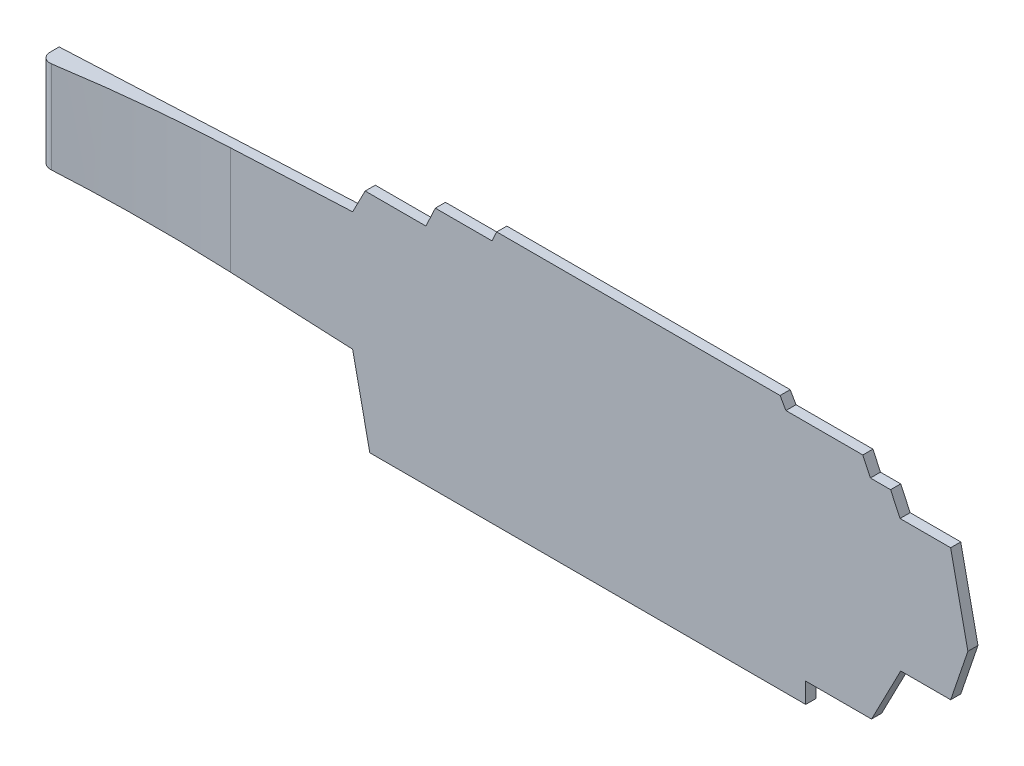
from build123d import *

# Parameters (mm, degrees)
EXTRUDE_1_DEPTH          = 50
EXTRUDE_3_DEPTH          = 50
CUT_EXTRUDE_2_DEPTH      = 4594.874479338
CUT_EXTRUDE_2_DEPTH_BACK = 4594.874479338
FILLET_4_R               = 50


with BuildPart() as part:
    # 草图1 → 凸台-拉伸1 (new body)
    with BuildSketch(Plane.XY):
        Polygon((0, 0), (0, 225), (1500, 294.39), (1562.072973457, 414.39), (1862.072973457, 414.39), (1908.703739273, 514.39), (2188.703739273, 514.39), (2212.019122181, 564.39), (3612.019122181, 564.39), (3640.88663564, 514.39), (4020.88663564, 514.39), (4058.191248292, 434.39), (4158.191248292, 434.39), (4204.822014108, 334.39), (4454.822014108, 334.39), (4539.989566047, -66.291829202), (4454.969566047, -316.291829202), (4208.14, -316.291829202), (4063.94, -594.39), (3738.77, -594.39), (3738.77, -694.39), (1585.02, -694.39), (1500, -293.676807666), (0, -224.286807666), align=None)
    extrude(amount=EXTRUDE_1_DEPTH)

    # 草图2 → 凸台-拉伸3 (add)
    with BuildSketch(Plane.XY.offset(50)):
        Polygon((0, 225), (1500, 294.39), (1500, -293.676807666), (0, -224.286807666), align=None)
    extrude(amount=EXTRUDE_3_DEPTH)

    # 草图8 → 切除-拉伸2 (cut, two sides: drawn at the far end of the back side and taken through both)
    with BuildSketch(Plane(origin=(0, 0, 0), x_dir=(1, 0, 0), z_dir=(0, 1, 0)).offset(-CUT_EXTRUDE_2_DEPTH_BACK)):
        with BuildLine():
            Line((1500, -50), (897.23, -50))
            ThreePointArc((897.23, -50), (447.918951588, -62.509689668), (0, -100))
            Line((0, -100), (1500, -286.15247301))
            Line((1500, -286.15247301), (1500, -50))
        make_face()
    extrude(amount=CUT_EXTRUDE_2_DEPTH + CUT_EXTRUDE_2_DEPTH_BACK, mode=Mode.SUBTRACT)

    # 圆角4
    fillet_4_edges = [part.edges().sort_by_distance(p)[0] for p in [
        (0, 0.356596167, 100),
    ]]
    fillet(fillet_4_edges, radius=FILLET_4_R)


solid = part.part
